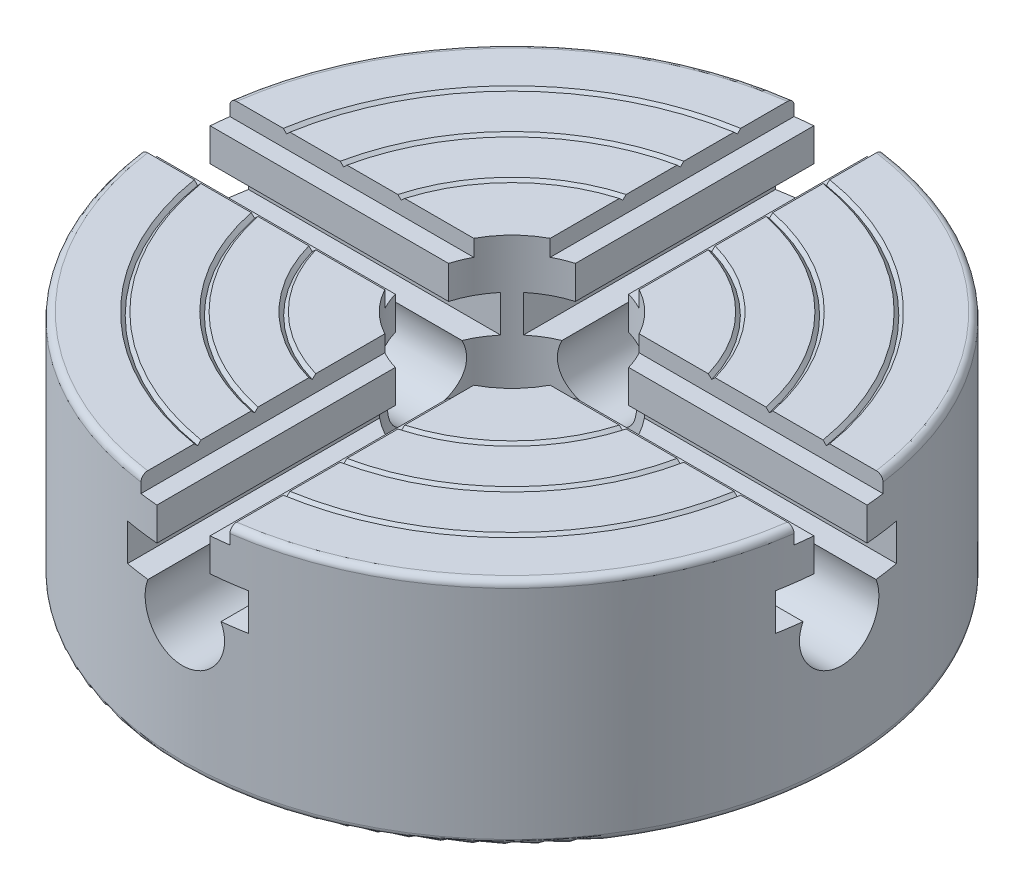
from build123d import *

# Parameters (mm, degrees)
SKETCH1_R                    = 100
BOSS_EXTRUDE1_DEPTH          = 70
SKETCH2_R                    = 50
SKETCH2_R_2                  = 48
CUT_EXTRUDE1_DEPTH           = 1
CUT_EXTRUDE1_DRAFT           = -45
SKETCH2_R_3                  = 67
SKETCH2_R_4                  = 65
CUT_EXTRUDE1_PROFILE_2_DEPTH = 1
CUT_EXTRUDE1_PROFILE_2_DRAFT = -45
SKETCH2_R_5                  = 84
SKETCH2_R_6                  = 82
CUT_EXTRUDE1_PROFILE_3_DEPTH = 1
CUT_EXTRUDE1_PROFILE_3_DRAFT = -45
SKETCH3_R                    = 28.5
CUT_EXTRUDE2_DEPTH           = 158.797338381
CUT_EXTRUDE3_DEPTH           = 158.797338381
CIRPATTERN1_COUNT            = 4
FILLET1_R                    = 2
SKETCH42_R                   = 13
CUT_EXTRUDE11_DEPTH          = 49
CIRPATTERN3_COUNT            = 4
SKETCH43_R                   = 87.5
SKETCH43_R_2                 = 55
CUT_EXTRUDE12_DEPTH          = 1
CUT_EXTRUDE12_DRAFT          = -45
SKETCH44_R                   = 8
CUT_EXTRUDE13_DEPTH          = 10
SKETCH45_R                   = 5.5
CUT_EXTRUDE14_DEPTH          = 7
CIRPATTERN59_COUNT           = 3
SKETCH52_R                   = 31.75
CUT_EXTRUDE15_DEPTH          = 11.11
CUT_EXTRUDE15_DRAFT          = -7
CHAMFER1_SIZE                = 1
CHAMFER1_SIZE2               = 1.148531798
FILLET2_R                    = 0.5


with BuildPart() as part:
    # Sketch1 → Boss-Extrude1 (new body)
    with BuildSketch(Plane(origin=(0, 0, 0), x_dir=(1, 0, 0), z_dir=(0, 1, 0))):
        Circle(SKETCH1_R)
    extrude(amount=BOSS_EXTRUDE1_DEPTH)


with BuildPart() as cut_extrude1_tool:
    # Sketch2 → Cut-Extrude1 (with draft: the straight prism first)
    with BuildSketch(Plane(origin=(0, 70, 0), x_dir=(1, 0, 0), z_dir=(0, 1, 0))):
        Circle(SKETCH2_R)
        Circle(SKETCH2_R_2, mode=Mode.SUBTRACT)
    extrude(amount=-CUT_EXTRUDE1_DEPTH)
    # Cut-Extrude1: the draft: its side faces are tilted about the plane it starts from
    cut_extrude1_sides = [cut_extrude1_tool.faces().sort_by_distance(p)[0] for p in [
        (-50, 69.5, 0),
        (-48, 69.5, 0),
    ]]
    draft(cut_extrude1_sides, Plane(origin=(0, 70, 0), x_dir=(1, 0, 0), z_dir=(0, 1, 0)), CUT_EXTRUDE1_DRAFT)


with BuildPart() as part_1:
    add(part.part)

    # Cut-Extrude1: cut by cut_extrude1_tool
    add(cut_extrude1_tool.part, mode=Mode.SUBTRACT)


with BuildPart() as cut_extrude1_profile_2_tool:
    # Sketch2 → Cut-Extrude1 profile 2 (with draft: the straight prism first)
    with BuildSketch(Plane(origin=(0, 70, 0), x_dir=(1, 0, 0), z_dir=(0, 1, 0))):
        Circle(SKETCH2_R_3)
        Circle(SKETCH2_R_4, mode=Mode.SUBTRACT)
    extrude(amount=-CUT_EXTRUDE1_PROFILE_2_DEPTH)
    # Cut-Extrude1 profile 2: the draft: its side faces are tilted about the plane it starts from
    cut_extrude1_profile_2_sides = [cut_extrude1_profile_2_tool.faces().sort_by_distance(p)[0] for p in [
        (-67, 69.5, 0),
        (-65, 69.5, 0),
    ]]
    draft(cut_extrude1_profile_2_sides, Plane(origin=(0, 70, 0), x_dir=(1, 0, 0), z_dir=(0, 1, 0)), CUT_EXTRUDE1_PROFILE_2_DRAFT)


with BuildPart() as part_2:
    add(part_1.part)

    # Cut-Extrude1 profile 2: cut by cut_extrude1_profile_2_tool
    add(cut_extrude1_profile_2_tool.part, mode=Mode.SUBTRACT)


with BuildPart() as cut_extrude1_profile_3_tool:
    # Sketch2 → Cut-Extrude1 profile 3 (with draft: the straight prism first)
    with BuildSketch(Plane(origin=(0, 70, 0), x_dir=(1, 0, 0), z_dir=(0, 1, 0))):
        Circle(SKETCH2_R_5)
        Circle(SKETCH2_R_6, mode=Mode.SUBTRACT)
    extrude(amount=-CUT_EXTRUDE1_PROFILE_3_DEPTH)
    # Cut-Extrude1 profile 3: the draft: its side faces are tilted about the plane it starts from
    cut_extrude1_profile_3_sides = [cut_extrude1_profile_3_tool.faces().sort_by_distance(p)[0] for p in [
        (-84, 69.5, 0),
        (-82, 69.5, 0),
    ]]
    draft(cut_extrude1_profile_3_sides, Plane(origin=(0, 70, 0), x_dir=(1, 0, 0), z_dir=(0, 1, 0)), CUT_EXTRUDE1_PROFILE_3_DRAFT)


with BuildPart() as part_3:
    add(part_2.part)

    # Cut-Extrude1 profile 3: cut by cut_extrude1_profile_3_tool
    add(cut_extrude1_profile_3_tool.part, mode=Mode.SUBTRACT)

    # Sketch3 → Cut-Extrude2 (cut, through all)
    with BuildSketch(Plane(origin=(0, 70, 0), x_dir=(1, 0, 0), z_dir=(0, 1, 0))):
        Circle(SKETCH3_R)
    extrude(amount=-CUT_EXTRUDE2_DEPTH, mode=Mode.SUBTRACT)

    # Sketch6 → Cut-Extrude3 (cut, through all)
    with BuildSketch(Plane(origin=(0, 0, 0), x_dir=(0, 0, -1), z_dir=(1, 0, 0))):
        with BuildLine():
            Line((13.5, 70), (-13.5, 70))
            Line((-13.5, 70), (-13.5, 65))
            Line((-13.5, 65), (-8.079745796, 65))
            Line((-8.079745796, 65), (-8.079745796, 55))
            Line((-8.079745796, 55), (-18.34970113, 55))
            Line((-18.34970113, 55), (-18.34970113, 43.8))
            Line((-18.34970113, 43.8), (-11.07429456, 43.8))
            ThreePointArc((-11.07429456, 43.8), (0, 27), (11.07429456, 43.8))
            Line((11.07429456, 43.8), (18.34970113, 43.8))
            Line((18.34970113, 43.8), (18.34970113, 55))
            Line((18.34970113, 55), (8.079745796, 55))
            Line((8.079745796, 55), (8.079745796, 65))
            Line((8.079745796, 65), (13.5, 65))
            Line((13.5, 65), (13.5, 70))
        make_face()
    cut_extrude3 = extrude(amount=CUT_EXTRUDE3_DEPTH, mode=Mode.SUBTRACT)

    # CirPattern1: Cut-Extrude3 ×4 about axis
    cirpattern1_axis = Axis((0, 0, 0), (0, 1, 0))
    for i in range(1, CIRPATTERN1_COUNT):
        add(cut_extrude3.rotate(cirpattern1_axis, i * 360 / CIRPATTERN1_COUNT), mode=Mode.SUBTRACT)

    # Fillet1
    fillet1_edges = [part_3.edges().sort_by_distance(p)[0] for p in [
        (-70.710678119, 70, 70.710678119),
        (-70.710678119, 70, -70.710678119),
        (70.710678119, 70, -70.710678119),
        (70.710678119, 70, 70.710678119),
        (-100, 0, 0),
    ]]
    fillet(fillet1_edges, radius=FILLET1_R)

    # Sketch42 → Cut-Extrude11 (cut)
    with BuildSketch(Plane(origin=(0, 0, 0), x_dir=(-1, 0, 0), z_dir=(0, -1, 0))):
        with Locations((0, -60)):
            Circle(SKETCH42_R)
    cut_extrude11 = extrude(amount=-CUT_EXTRUDE11_DEPTH, mode=Mode.SUBTRACT)

    # CirPattern3: Cut-Extrude11 ×4 about axis
    cirpattern3_axis = Axis((0, 70, 0), (0, -1, 0))
    for i in range(1, CIRPATTERN3_COUNT):
        add(cut_extrude11.rotate(cirpattern3_axis, i * 360 / CIRPATTERN3_COUNT), mode=Mode.SUBTRACT)


with BuildPart() as cut_extrude12_tool:
    # Sketch43 → Cut-Extrude12 (with draft: the straight prism first)
    with BuildSketch(Plane.XZ):
        Circle(SKETCH43_R)
        Circle(SKETCH43_R_2, mode=Mode.SUBTRACT)
    extrude(amount=-CUT_EXTRUDE12_DEPTH)
    # Cut-Extrude12: the draft: its side faces are tilted about the plane it starts from
    cut_extrude12_sides = [cut_extrude12_tool.faces().sort_by_distance(p)[0] for p in [
        (-87.5, 0.5, 0),
        (-55, 0.5, 0),
    ]]
    draft(cut_extrude12_sides, Plane.XZ, CUT_EXTRUDE12_DRAFT)


with BuildPart() as part_4:
    add(part_3.part)

    # Cut-Extrude12: cut by cut_extrude12_tool
    add(cut_extrude12_tool.part, mode=Mode.SUBTRACT)

    # Sketch44 → Cut-Extrude13 (cut)
    with BuildSketch(Plane.XZ):
        with Locations((-28.991378029, -28.991378029)):
            Circle(SKETCH44_R)
    cut_extrude13 = extrude(amount=-CUT_EXTRUDE13_DEPTH, mode=Mode.SUBTRACT)

    # Sketch45 → Cut-Extrude14 (cut)
    with BuildSketch(Plane.XZ):
        with Locations((-34.24712895, -18.762639971)):
            Circle(SKETCH45_R)
    cut_extrude14 = extrude(amount=-CUT_EXTRUDE14_DEPTH, mode=Mode.SUBTRACT)

    # Sketch49 → M10x1.0 Tapped Hole5 (revolve, cut)
    with BuildSketch(Plane(origin=(-28.991378029, 10, -28.991378029), x_dir=(0, 0, -1), z_dir=(1, 0, 0))):
        Polygon((0, 0), (0, 23), (4.5, 20.296127214), (4.5, 0), align=None)
    m10x1_0_tapped_hole5 = revolve(axis=Axis((-28.991378029, 3.65, -28.991378029), (0, 1, 0)), mode=Mode.SUBTRACT)

    # Sketch51 → M6x1.0 Tapped Hole8 (revolve, cut)
    with BuildSketch(Plane(origin=(-34.24712895, 7, -18.762639971), x_dir=(0, 0, -1), z_dir=(1, 0, 0))):
        Polygon((0, 0), (0, 20), (2.5, 18.497848452), (2.5, 0), align=None)
    m6x1_0_tapped_hole8 = revolve(axis=Axis((-34.24712895, 0.65, -18.762639971), (0, 1, 0)), mode=Mode.SUBTRACT)

    # CirPattern59: Cut-Extrude13, Cut-Extrude14, M10x1.0 Tapped Hole5, M6x1.0 Tapped Hole8 ×3 about axis
    cirpattern59_axis = Axis((0, 0, 0), (0, 1, 0))
    add([cut_extrude13.rotate(cirpattern59_axis, i * 360 / CIRPATTERN59_COUNT) for i in range(1, CIRPATTERN59_COUNT)], mode=Mode.SUBTRACT)
    add([cut_extrude14.rotate(cirpattern59_axis, i * 360 / CIRPATTERN59_COUNT) for i in range(1, CIRPATTERN59_COUNT)], mode=Mode.SUBTRACT)
    add([m10x1_0_tapped_hole5.rotate(cirpattern59_axis, i * 360 / CIRPATTERN59_COUNT) for i in range(1, CIRPATTERN59_COUNT)], mode=Mode.SUBTRACT)
    add([m6x1_0_tapped_hole8.rotate(cirpattern59_axis, i * 360 / CIRPATTERN59_COUNT) for i in range(1, CIRPATTERN59_COUNT)], mode=Mode.SUBTRACT)


with BuildPart() as cut_extrude15_tool:
    # Sketch52 → Cut-Extrude15 (with draft: the straight prism first)
    with BuildSketch(Plane.XZ):
        Circle(SKETCH52_R)
    extrude(amount=-CUT_EXTRUDE15_DEPTH)
    # Cut-Extrude15: the draft: its side faces are tilted about the plane it starts from
    cut_extrude15_sides = [cut_extrude15_tool.faces().sort_by_distance(p)[0] for p in [
        (-31.75, 5.555, 0),
    ]]
    draft(cut_extrude15_sides, Plane.XZ, CUT_EXTRUDE15_DRAFT)


with BuildPart() as part_5:
    add(part_4.part)

    # Cut-Extrude15: cut by cut_extrude15_tool
    add(cut_extrude15_tool.part, mode=Mode.SUBTRACT)

    # Chamfer1
    chamfer1_edges = [part_5.edges().sort_by_distance(p)[0] for p in [
        (-31.75, 0, 0),
    ]]
    chamfer1_side = [part_5.faces().sort_by_distance(p)[0] for p in [
        (-37.814872965, 0, 37.814872965),
    ]]
    chamfer(chamfer1_edges, length=CHAMFER1_SIZE, length2=CHAMFER1_SIZE2, reference=chamfer1_side[0])

    # Fillet2
    fillet2_edges = [part_5.edges().sort_by_distance(p)[0] for p in [
        (-30.385863528, 11.11, 0),
    ]]
    fillet(fillet2_edges, radius=FILLET2_R)


solid = part_5.part
